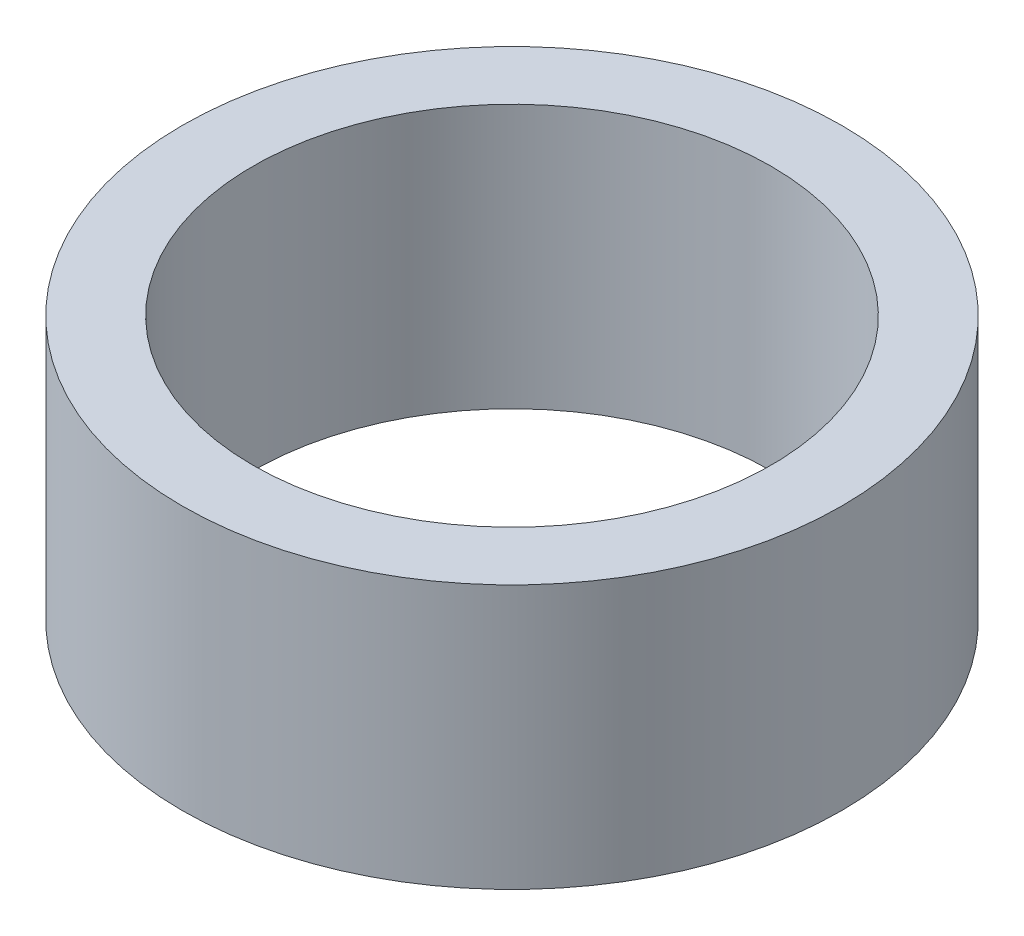
from build123d import *

# Parameters (mm, degrees)
SKETCH1_R           = 35
BOSS_EXTRUDE1_DEPTH = 28
SKETCH2_R           = 27.5
CUT_EXTRUDE1_DEPTH  = 57.868268832


with BuildPart() as part:
    # Sketch1 → Boss-Extrude1 (new body)
    with BuildSketch(Plane(origin=(0, 0, 0), x_dir=(1, 0, 0), z_dir=(0, 1, 0))):
        Circle(SKETCH1_R)
    extrude(amount=BOSS_EXTRUDE1_DEPTH)

    # Sketch2 → Cut-Extrude1 (cut, through all)
    with BuildSketch(Plane(origin=(0, 0, 0), x_dir=(1, 0, 0), z_dir=(0, 1, 0))):
        Circle(SKETCH2_R)
    extrude(amount=CUT_EXTRUDE1_DEPTH, mode=Mode.SUBTRACT)


solid = part.part
